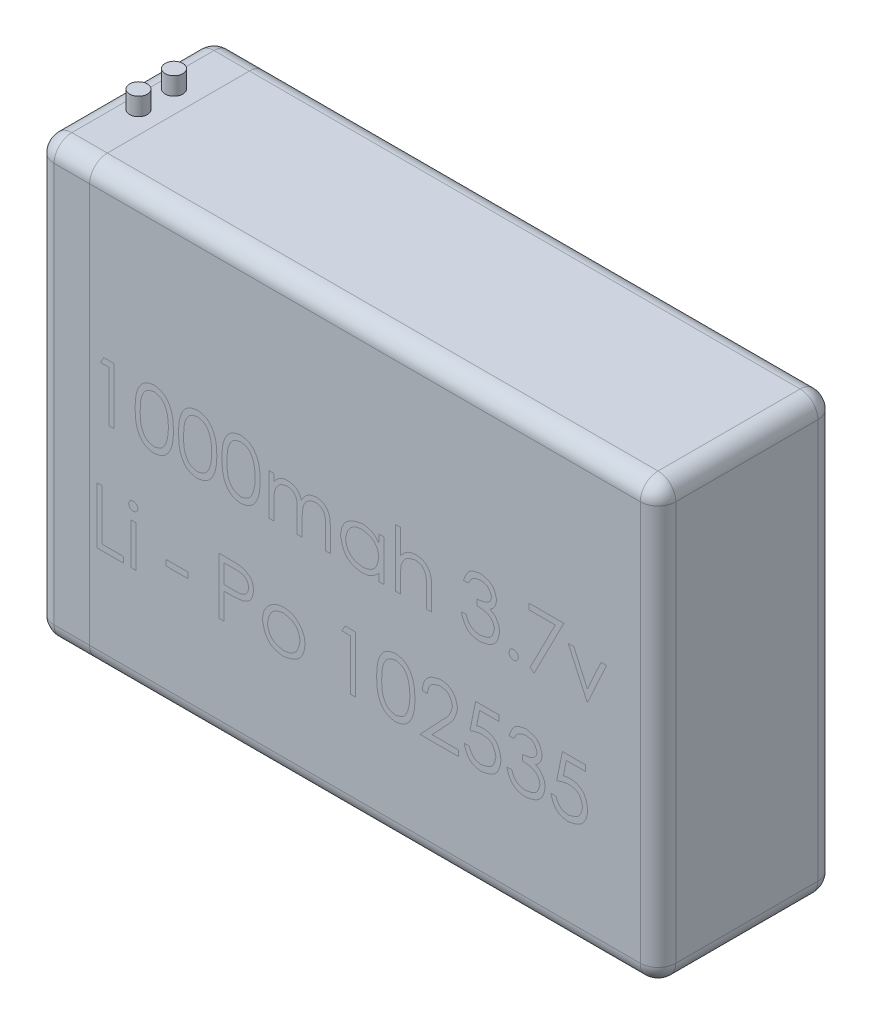
from build123d import *

# Parameters (mm, degrees)
SKETCH1_W           = 35
SKETCH1_H           = 24.5
BOSS_EXTRUDE1_DEPTH = 5
FILLET1_R           = 1
SKETCH3_R           = 0.5
BOSS_EXTRUDE2_DEPTH = 1


with BuildPart() as part:
    # Sketch1 → Boss-Extrude1 (new, symmetric)
    with BuildSketch(Plane.XY):
        Rectangle(SKETCH1_W, SKETCH1_H)
    extrude(amount=BOSS_EXTRUDE1_DEPTH, both=True)

    # Fillet1
    fillet1_edges = [part.edges().sort_by_distance(p)[0] for p in [
        (17.5, 12.25, 0),
        (-17.5, 12.25, 0),
        (-17.5, -12.25, 0),
        (17.5, -12.25, 0),
        (0, -12.25, 5),
        (-17.5, 0, 5),
        (0, 12.25, 5),
        (17.5, 0, 5),
        (0, -12.25, -5),
        (-17.5, 0, -5),
        (0, 12.25, -5),
        (17.5, 0, -5),
    ]]
    fillet(fillet1_edges, radius=FILLET1_R)

    # Sketch3 → Boss-Extrude2 (add)
    with BuildSketch(Plane(origin=(0, 12.25, 0), x_dir=(1, 0, 0), z_dir=(0, 1, 0))):
        with Locations((-15.75, 1)):
            Circle(SKETCH3_R)
        with Locations((-15.75, -1)):
            Circle(SKETCH3_R)
    extrude(amount=BOSS_EXTRUDE2_DEPTH)


solid = part.part
